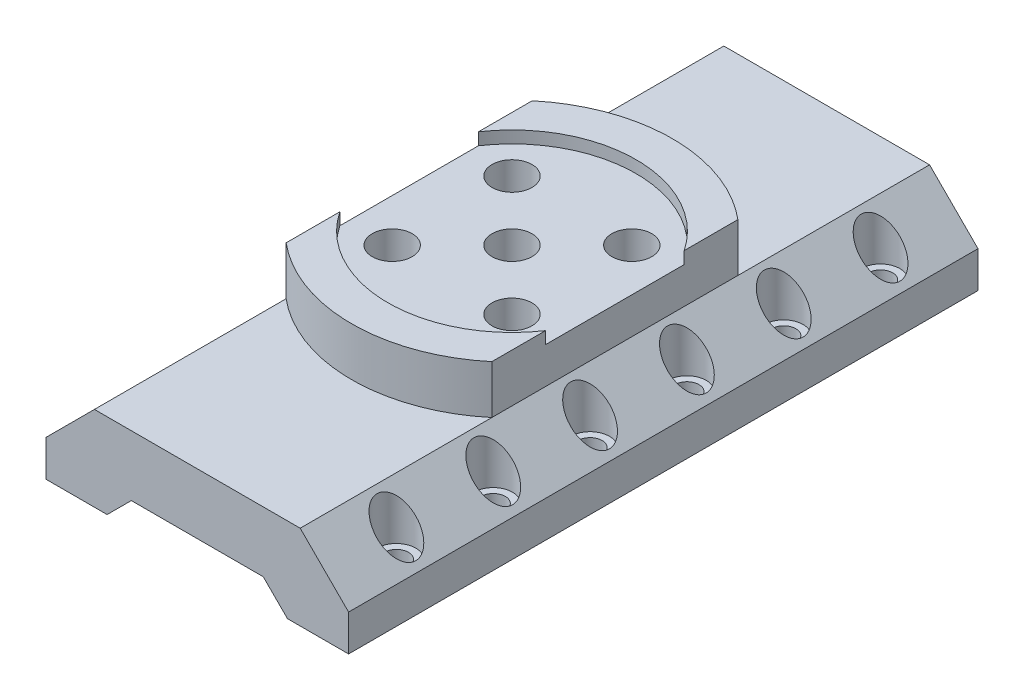
from build123d import *

# Parameters (mm, degrees)
SKETCH1_W           = 25
SKETCH1_H           = 52
BOSS_EXTRUDE1_DEPTH = 7
SKETCH2_R           = 1
CUT_EXTRUDE1_DEPTH  = 30.685855218
LPATTERN1_COUNT     = 6
LPATTERN1_PITCH     = 8
SKETCH9_R           = 1.65
SKETCH9_R_2         = 1.6
CUT_EXTRUDE3_DEPTH  = 4.25
LPATTERN2_COUNT     = 6
LPATTERN2_PITCH     = 8
CHAMFER2_SIZE       = 4
SKETCH10_W          = 14.9
SKETCH10_H          = 52
CUT_EXTRUDE4_DEPTH  = 2
CHAMFER3_SIZE       = 2
BOSS_EXTRUDE2_DEPTH = 3
BOSS_EXTRUDE3_DEPTH = 4
SKETCH13_R          = 1.65
CUT_EXTRUDE5_DEPTH  = 3
CUT_EXTRUDE6_REACH  = 31.686
SKETCH14_R          = 3


# Some blends are built 0.0001 mm under size
with BuildPart() as part:
    # Sketch1 → Boss-Extrude1 (new body)
    with BuildSketch(Plane(origin=(0, 0, 0), x_dir=(1, 0, 0), z_dir=(0, 1, 0))):
        Rectangle(SKETCH1_W, SKETCH1_H)
    extrude(amount=BOSS_EXTRUDE1_DEPTH)

    # Sketch2 → Cut-Extrude1 (cut, through all)
    with BuildSketch(Plane(origin=(0, 7, 0), x_dir=(1, 0, 0), z_dir=(0, 1, 0))):
        with Locations(Location((-10.45, -20, 0), (0, 0, 270))):
            Circle(SKETCH2_R)
        with Locations(Location((10.45, -20, 0), (0, 0, 270))):
            Circle(SKETCH2_R)
    cut_extrude1 = extrude(amount=-CUT_EXTRUDE1_DEPTH, mode=Mode.SUBTRACT)

    # LPattern1: Cut-Extrude1 ×6
    with Locations(*[(0, 0, -i * LPATTERN1_PITCH) for i in range(1, LPATTERN1_COUNT)]):
        add(cut_extrude1, mode=Mode.SUBTRACT)

    # Sketch9 → Cut-Extrude3 (cut)
    with BuildSketch(Plane(origin=(0, 7, 0), x_dir=(1, 0, 0), z_dir=(0, 1, 0))):
        with Locations(Location((-10.45, 20, 0), (0, 0, 270))):
            Circle(SKETCH9_R)
        with Locations(Location((10.45, 20, 0), (0, 0, 270))):
            Circle(SKETCH9_R_2)
    cut_extrude3 = extrude(amount=-CUT_EXTRUDE3_DEPTH, mode=Mode.SUBTRACT)

    # LPattern2: Cut-Extrude3 ×6
    with Locations(*[(0, 0, i * LPATTERN2_PITCH) for i in range(1, LPATTERN2_COUNT)]):
        add(cut_extrude3, mode=Mode.SUBTRACT)

    # Chamfer2
    # the kernel refuses this chamfer: 4 mm, written as the material it takes off along each edge
    with BuildSketch(Plane(origin=(-12.5, 7, -36.286731952), x_dir=(-0.027495876610586487, -0.9996219169112968, 0), z_dir=(0, 0, 1)), Plane(origin=(12.5, 7, 36.286731952), x_dir=(0.027495876610586487, -0.9996219169112968, 0), z_dir=(0, 0, -1))) as chamfer2_piece_1:
        Polygon((CHAMFER2_SIZE * 0.999621916911, CHAMFER2_SIZE * 0.0274958766106), (-CHAMFER2_SIZE * 0.0274958766106, CHAMFER2_SIZE * 0.999621916911), (0, 0), align=None)
    extrude(amount=72.573463904, mode=Mode.SUBTRACT)

    # Sketch10 → Cut-Extrude4 (cut)
    with BuildSketch(Plane.XZ):
        Rectangle(SKETCH10_W, SKETCH10_H)
    extrude(amount=-CUT_EXTRUDE4_DEPTH, mode=Mode.SUBTRACT)

    # Chamfer3
    chamfer3_edges = [part.edges().sort_by_distance(p)[0] for p in [
        (7.45, 2, 0),
        (-7.45, 2, 0),
    ]]
    chamfer(chamfer3_edges, length=CHAMFER3_SIZE - 0.0001)  # a hair under: the kernel refuses the full size

    # Sketch12 → Boss-Extrude2 (add)
    with BuildSketch(Plane(origin=(0, 7, 0), x_dir=(1, 0, 0), z_dir=(0, 1, 0))):
        with BuildLine():
            ThreePointArc((8.5, 5.728219619), (0, 10.25), (-8.5, 5.728219619))
            Line((-8.5, 5.728219619), (-8.5, -5.728219619))
            ThreePointArc((-8.5, -5.728219619), (0, -10.25), (8.5, -5.728219619))
            Line((8.5, -5.728219619), (8.5, 5.728219619))
        make_face()
    extrude(amount=BOSS_EXTRUDE2_DEPTH)

    # Sketch12<3> → Boss-Extrude3 (add)
    with BuildSketch(Plane(origin=(0, 7, 0), x_dir=(1, 0, 0), z_dir=(0, 1, 0))):
        with BuildLine():
            ThreePointArc((8.5, 10.164275675), (0, 13.25), (-8.5, 10.164275675))
            Line((-8.5, 10.164275675), (-8.5, 5.728219619))
            ThreePointArc((-8.5, 5.728219619), (0, 10.25), (8.5, 5.728219619))
            Line((8.5, 5.728219619), (8.5, 10.164275675))
        make_face()
        with BuildLine():
            Line((-8.5, -5.728219619), (-8.5, -10.164275675))
            ThreePointArc((-8.5, -10.164275675), (0, -13.25), (8.5, -10.164275675))
            Line((8.5, -10.164275675), (8.5, -5.728219619))
            ThreePointArc((8.5, -5.728219619), (0, -10.25), (-8.5, -5.728219619))
        make_face()
    extrude(amount=BOSS_EXTRUDE3_DEPTH)

    # Sketch13 → Cut-Extrude5 (cut)
    with BuildSketch(Plane(origin=(0, 10, 0), x_dir=(1, 0, 0), z_dir=(0, 1, 0))):
        with Locations(Location((-4.949747468, 4.949747468, 0), (0, 0, 270))):
            Circle(SKETCH13_R)
        with Locations(Location((4.949747468, 4.949747468, 0), (0, 0, 270))):
            Circle(SKETCH13_R)
        with Locations(Location((4.949747468, -4.949747468, 0), (0, 0, 270))):
            Circle(SKETCH13_R)
        with Locations(Location((-4.949747468, -4.949747468, 0), (0, 0, 270))):
            Circle(SKETCH13_R)
        with Locations(Location((0, 0, 0), (0, 0, 270))):
            Circle(SKETCH13_R)
    extrude(amount=-CUT_EXTRUDE5_DEPTH, mode=Mode.SUBTRACT)

    # Sketch14 → Cut-Extrude6 (cut, up to next)
    with BuildSketch(Plane(origin=(0, 7, 0), x_dir=(1, 0, 0), z_dir=(0, 1, 0)), mode=Mode.PRIVATE) as cut_extrude6_sk1:
        with Locations(Location((-4.949747468, 4.949747468, 0), (0, 0, 270))):
            Circle(SKETCH14_R)
    cut_extrude6_tool1 = extrude(cut_extrude6_sk1.sketch, amount=-CUT_EXTRUDE6_REACH, mode=Mode.PRIVATE) & part.part
    # Sketch14 → Cut-Extrude6 (cut, up to next)
    with BuildSketch(Plane(origin=(0, 7, 0), x_dir=(1, 0, 0), z_dir=(0, 1, 0)), mode=Mode.PRIVATE) as cut_extrude6_sk2:
        with Locations(Location((4.949747468, 4.949747468, 0), (0, 0, 270))):
            Circle(SKETCH14_R)
    cut_extrude6_tool2 = extrude(cut_extrude6_sk2.sketch, amount=-CUT_EXTRUDE6_REACH, mode=Mode.PRIVATE) & part.part
    # Sketch14 → Cut-Extrude6 (cut, up to next)
    with BuildSketch(Plane(origin=(0, 7, 0), x_dir=(1, 0, 0), z_dir=(0, 1, 0)), mode=Mode.PRIVATE) as cut_extrude6_sk3:
        with Locations(Location((4.949747468, -4.949747468, 0), (0, 0, 270))):
            Circle(SKETCH14_R)
    cut_extrude6_tool3 = extrude(cut_extrude6_sk3.sketch, amount=-CUT_EXTRUDE6_REACH, mode=Mode.PRIVATE) & part.part
    # Sketch14 → Cut-Extrude6 (cut, up to next)
    with BuildSketch(Plane(origin=(0, 7, 0), x_dir=(1, 0, 0), z_dir=(0, 1, 0)), mode=Mode.PRIVATE) as cut_extrude6_sk4:
        with Locations(Location((-4.949747468, -4.949747468, 0), (0, 0, 270))):
            Circle(SKETCH14_R)
    cut_extrude6_tool4 = extrude(cut_extrude6_sk4.sketch, amount=-CUT_EXTRUDE6_REACH, mode=Mode.PRIVATE) & part.part
    # Sketch14 → Cut-Extrude6 (cut, up to next)
    with BuildSketch(Plane(origin=(0, 7, 0), x_dir=(1, 0, 0), z_dir=(0, 1, 0)), mode=Mode.PRIVATE) as cut_extrude6_sk5:
        with Locations(Location((0, 0, 0), (0, 0, 270))):
            Circle(SKETCH14_R)
    cut_extrude6_tool5 = extrude(cut_extrude6_sk5.sketch, amount=-CUT_EXTRUDE6_REACH, mode=Mode.PRIVATE) & part.part
    add(cut_extrude6_tool1.solids().sort_by_distance((-4.949747, 7, -4.949747))[0], mode=Mode.SUBTRACT)
    add(cut_extrude6_tool2.solids().sort_by_distance((4.949747, 7, -4.949747))[0], mode=Mode.SUBTRACT)
    add(cut_extrude6_tool3.solids().sort_by_distance((4.949747, 7, 4.949747))[0], mode=Mode.SUBTRACT)
    add(cut_extrude6_tool4.solids().sort_by_distance((-4.949747, 7, 4.949747))[0], mode=Mode.SUBTRACT)
    add(cut_extrude6_tool5.solids().sort_by_distance((0, 7, 0))[0], mode=Mode.SUBTRACT)


solid = part.part
